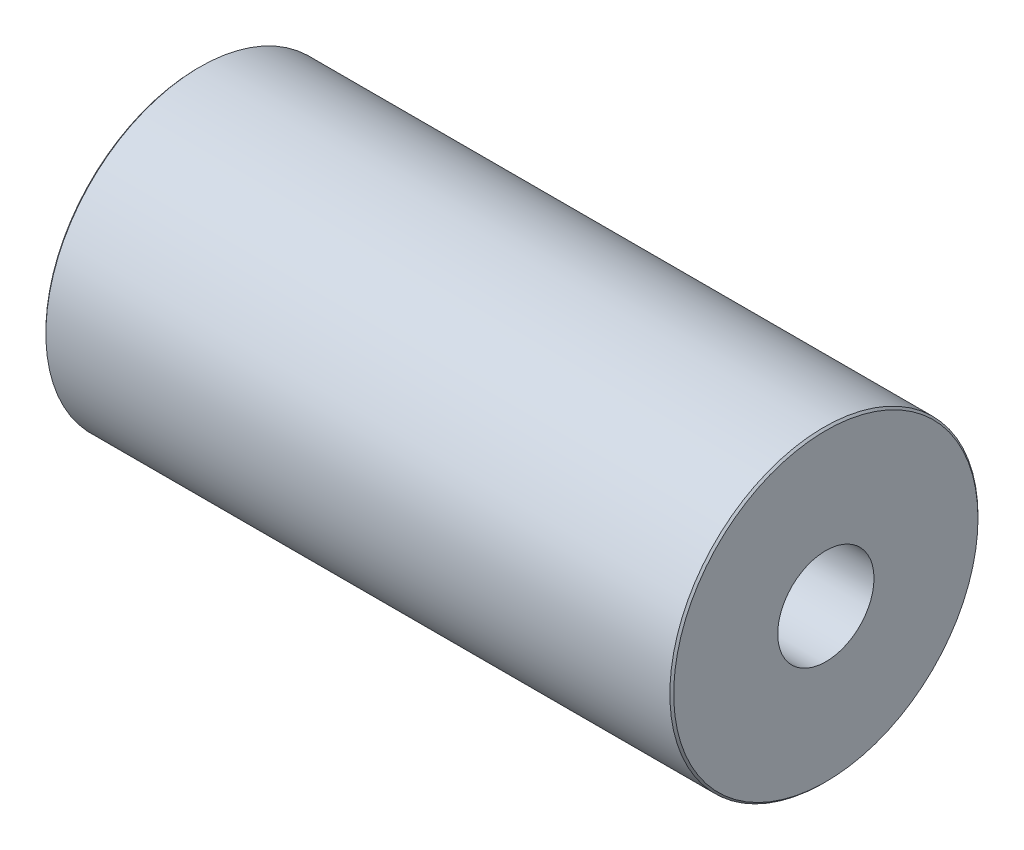
from build123d import *

# Parameters (mm, degrees)
SKETCH1_R           = 8
BOSS_EXTRUDE1_DEPTH = 16.3
CHAMFER1_SIZE       = 0.1


with BuildPart() as part:
    # Sketch1 → Boss-Extrude1 (new, symmetric)
    with BuildSketch(Plane(origin=(0, 0, 0), x_dir=(0, 0, -1), z_dir=(1, 0, 0))):
        Circle(SKETCH1_R)
    extrude(amount=BOSS_EXTRUDE1_DEPTH, both=True)

    # Sketch3 → M6 Tapped Hole1 (revolve, cut)
    with BuildSketch(Plane(origin=(-16.3, 0, 0), x_dir=(0, 0, 1), z_dir=(0, 1, 0))):
        Polygon((0, 0), (0, 11.502151548), (2.5, 10), (2.5, 0), align=None)
    m6_tapped_hole1 = revolve(axis=Axis((-22.65, 0, 0), (1, 0, 0)), mode=Mode.SUBTRACT)

    # Mirror1: M6 Tapped Hole1 across plane
    add(m6_tapped_hole1.mirror(Plane(origin=(0, 0, 0), x_dir=(0, 0, 1), z_dir=(1, 0, 0))), mode=Mode.SUBTRACT)

    # Chamfer1
    chamfer1_edges = [part.edges().sort_by_distance(p)[0] for p in [
        (-16.3, 0, 8),
        (16.3, 0, 8),
    ]]
    chamfer(chamfer1_edges, length=CHAMFER1_SIZE)


solid = part.part
